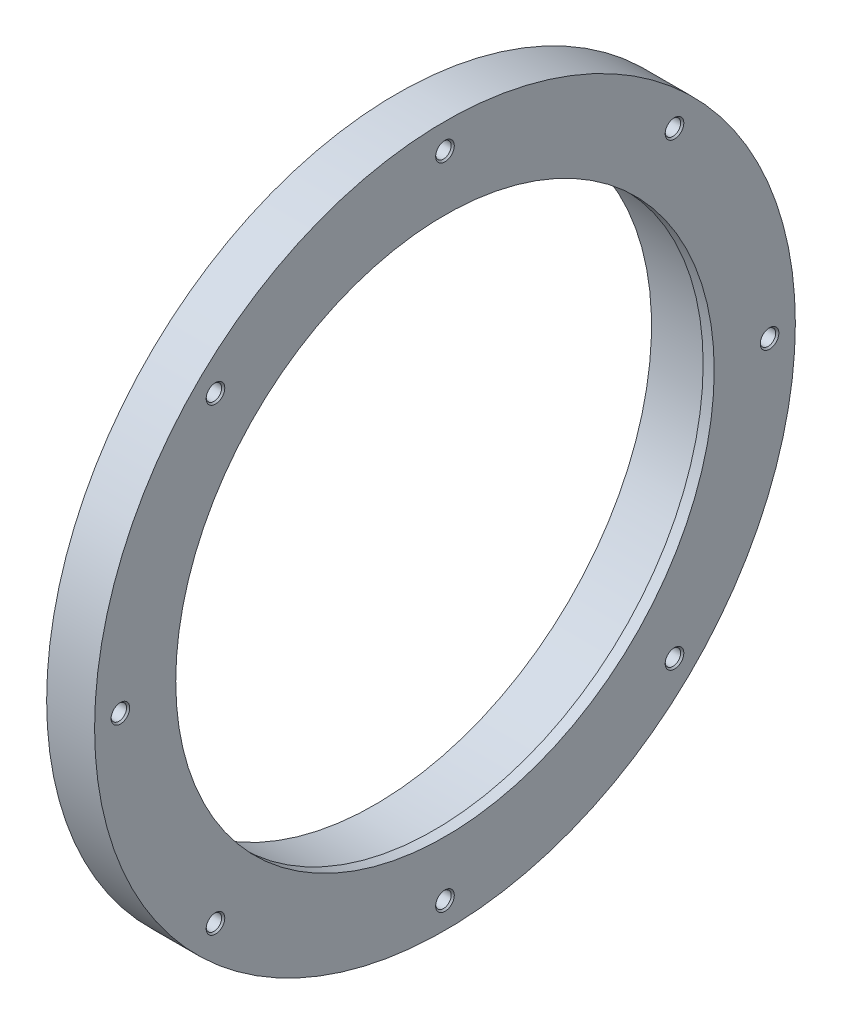
from build123d import *

# Parameters (mm, degrees)
OTW_R_GWINTOWANY_M51_D           = 4.2
OTW_R_GWINTOWANY_M51_CSINK_D     = 5.05
OTW_R_GWINTOWANY_M51_CSINK_ANGLE = 90


with BuildPart() as part:
    # Szkic1 → Obrót1 (revolve)
    with BuildSketch(Plane.XY):
        Polygon((18.999999909, 95.000000207), (5.999999909, 95.000000207), (5.999999909, 80), (-9.1e-08, 80), (-9.1e-08, 75.000000207), (15.999999909, 75.000000207), (15.999999909, 73.000000207), (18.999999909, 73.000000207), align=None)
    revolve(axis=Axis((0, 0, 0), (1, 0, 0)))

    # Otwór gwintowany M51 (through all)
    with Locations(Plane(origin=(18.999999909, 0, 0), x_dir=(0, 0, -1), z_dir=(1, 0, 0))):
        with Locations((0, 88), (62.225396744, 62.225396744), (88, 0), (62.225396744, -62.225396744), (0, -88), (-62.225396744, -62.225396744), (-88, 0), (-62.225396744, 62.225396744), (0, 0)):
            CounterSinkHole(OTW_R_GWINTOWANY_M51_D / 2, OTW_R_GWINTOWANY_M51_CSINK_D / 2, counter_sink_angle=OTW_R_GWINTOWANY_M51_CSINK_ANGLE)


solid = part.part
